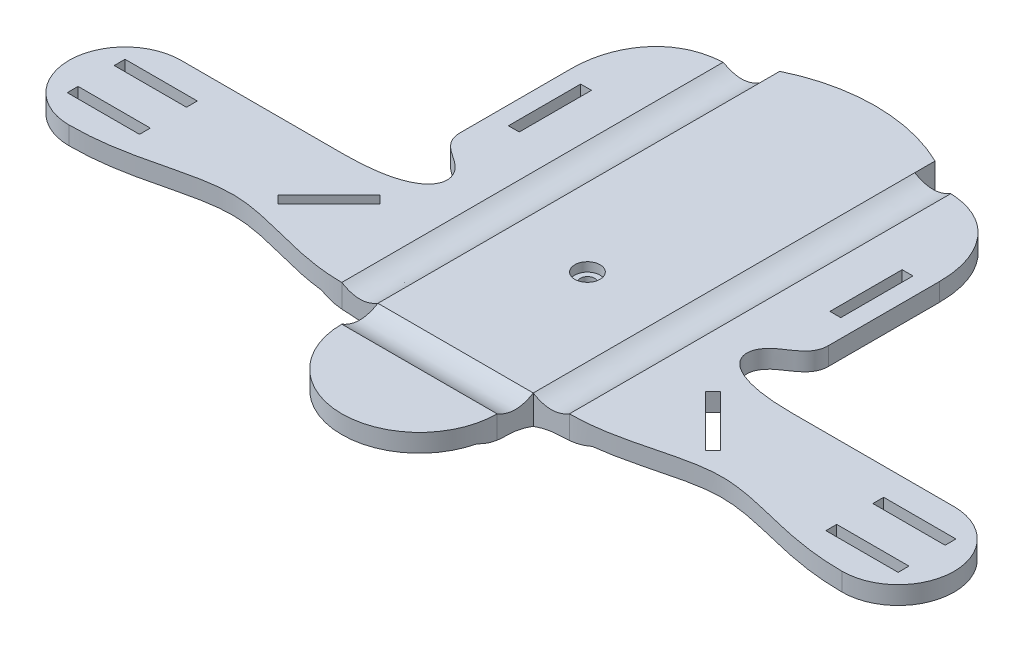
from build123d import *

# Parameters (mm, degrees)
SANDAL_DESIGN_W         = 20
SANDAL_DESIGN_H         = 3
SANDAL_DESIGN_W_2       = 3
SANDAL_DESIGN_H_2       = 20
BOSS_EXTRUDE1_DEPTH     = 8
BOSS_EXTRUDE2_DEPTH     = 2.5
CUT_EXTRUDE3_REACH      = 204.072
SKETCH6_R               = 2
SKETCH7_R               = 3.5
CUT_EXTRUDE4_DEPTH      = 2.5
CUT_EXTRUDE5_DEPTH      = 202.957076727
CUT_EXTRUDE5_DEPTH_BACK = 202.957076727
CUT_EXTRUDE6_DEPTH      = 202.957076669
CUT_EXTRUDE6_DEPTH_BACK = 202.957076669


with BuildPart() as part:
    # Sandal Design → Boss-Extrude1 (new body)
    with BuildSketch(Plane(origin=(0, 0, 0), x_dir=(1, 0, 0), z_dir=(0, 1, 0))):
        with BuildLine():
            Line((12.5, 105.618176015), (21, 105.618176015))
            Line((21, 105.618176015), (21, 111.2308341))
            ThreePointArc((21, 111.2308341), (42.5, 116.179433559), (64, 111.2308341))
            Line((64, 111.2308341), (64, 105.618176015))
            Line((64, 105.618176015), (72.5, 105.618176015))
            add(Edge.make_bspline(
                [(93.5, 82.999999948), (93.5, 91.196820649), (88.204207077, 102.224600535), (77.563477886, 105.618176015), (72.5, 105.618176015)],
                knots=[0, 0, 0, 0, 0.612935635, 1, 1, 1, 1], degree=3))
            Line((93.5, 82.999999948), (93.5, 52.191849548))
            add(Edge.make_bspline(
                [(93.5, 52.191849548), (93.5, 47.540394127), (80.104553071, 43.201826505), (83.23130825, 31.001751884), (104.5, 31.001751884)],
                knots=[0, 0, 0, 0, 0.331226387, 1, 1, 1, 1], degree=3))
            Line((104.5, 31.001751884), (149.5, 31.001751884))
            ThreePointArc((149.5, 31.001751884), (165, 15.501651435), (149.499799102, 0.001751885))
            add(Edge.make_bspline(
                [(74, 0), (87.494084825, 0), (111.347806875, 12.069263412), (131.926415328, 0.001979657), (149.499799102, 0.001751885)],
                knots=[0, 0, 0, 0, 0.462855682, 1, 1, 1, 1], degree=3))
            Line((74, 0), (64, 0))
            Line((64, 0), (64, -10))
            ThreePointArc((64, -10), (42.5, -31.5), (21, -10))
            Line((21, -10), (21, 0))
            Line((21, 0), (11, 0))
            add(Edge.make_bspline(
                [(11, 0), (-2.494084825, 0), (-26.347806875, 12.069263412), (-46.926415328, 0.001979657), (-64.499799102, 0.001751885)],
                knots=[0, 0, 0, 0, 0.462855682, 1, 1, 1, 1], degree=3))
            ThreePointArc((-64.499799102, 0.001751885), (-80, 15.501651435), (-64.5, 31.001751884))
            Line((-64.5, 31.001751884), (-19.5, 31.001751884))
            add(Edge.make_bspline(
                [(-8.5, 52.191849548), (-8.5, 47.540394127), (4.895446929, 43.201826505), (1.76869175, 31.001751884), (-19.5, 31.001751884)],
                knots=[0, 0, 0, 0, 0.331226387, 1, 1, 1, 1], degree=3))
            Line((-8.5, 52.191849548), (-8.5, 82.999999948))
            add(Edge.make_bspline(
                [(-8.5, 82.999999948), (-8.5, 91.196820649), (-3.204207077, 102.224600535), (7.436522114, 105.618176015), (12.5, 105.618176015)],
                knots=[0, 0, 0, 0, 0.612935635, 1, 1, 1, 1], degree=3))
        make_face()
        Polygon((101.642135624, 10), (103.763455967, 12.121320344), (89.621320344, 26.263455967), (87.5, 24.142135624), align=None, mode=Mode.SUBTRACT)
        Polygon((157.5, 23.501751884), (137.5, 23.501751884), (137.5, 20.501751884), (157.5, 20.501751885), align=None, mode=Mode.SUBTRACT)
        with Locations((147.5, 9.001751885)):
            Rectangle(SANDAL_DESIGN_W, SANDAL_DESIGN_H, mode=Mode.SUBTRACT)
        Polygon((-4.621320344, 26.263455967), (-2.5, 24.142135624), (-16.642135624, 10), (-18.763455967, 12.121320344), align=None, mode=Mode.SUBTRACT)
        Polygon((-52.5, 23.501751884), (-52.5, 20.501751884), (-72.5, 20.501751885), (-72.5, 23.501751884), align=None, mode=Mode.SUBTRACT)
        with Locations((-62.5, 9.001751885)):
            Rectangle(SANDAL_DESIGN_W, SANDAL_DESIGN_H, mode=Mode.SUBTRACT)
        with Locations((-2, 70.618176015)):
            Rectangle(SANDAL_DESIGN_W_2, SANDAL_DESIGN_H_2, mode=Mode.SUBTRACT)
        with Locations((87, 70.618176015)):
            Rectangle(SANDAL_DESIGN_W_2, SANDAL_DESIGN_H_2, mode=Mode.SUBTRACT)
    extrude(amount=BOSS_EXTRUDE1_DEPTH)

    # Sketch4 → Boss-Extrude2 (add)
    with BuildSketch(Plane.XZ):
        with BuildLine():
            Line((64, -15.577524047), (64, -57.422475953))
            ThreePointArc((64, -57.422475953), (42.5, -66.5), (21, -57.422475953))
            Line((21, -57.422475953), (21, -15.577524047))
            ThreePointArc((21, -15.577524047), (42.5, -6.5), (64, -15.577524047))
        make_face()
    extrude(amount=BOSS_EXTRUDE2_DEPTH)

    # Sketch6 → Cut-Extrude3 (cut, up to next)
    with BuildSketch(Plane.XZ.offset(2.5), mode=Mode.PRIVATE) as cut_extrude3_sk1:
        with Locations((42.5, -36.5)):
            Circle(SKETCH6_R)
    cut_extrude3_tool1 = extrude(cut_extrude3_sk1.sketch, amount=-CUT_EXTRUDE3_REACH, mode=Mode.PRIVATE) & part.part
    add(cut_extrude3_tool1.solids().sort_by_distance((42.5, -2.5, -36.5))[0], mode=Mode.SUBTRACT)

    # Sketch7 → Cut-Extrude4 (cut)
    with BuildSketch(Plane(origin=(0, 8, 0), x_dir=(1, 0, 0), z_dir=(0, 1, 0))):
        with Locations((42.5, 36.5)):
            Circle(SKETCH7_R)
    extrude(amount=-CUT_EXTRUDE4_DEPTH, mode=Mode.SUBTRACT)

    # Sketch8 → Cut-Extrude5 (cut, two sides: drawn at the far end of the back side and taken through both)
    with BuildSketch(Plane.XY.offset(-CUT_EXTRUDE5_DEPTH_BACK)):
        with BuildLine():
            Line((-80, 3), (-80, 0))
            Line((-80, 0), (21, 0))
            add(Edge.make_bspline(
                [(21, 0), (18.333333333, 1), (15.666666667, 1.5), (10.333333332, 1.5), (7.666665836, 2), (5, 3)],
                knots=[0, 0, 0, 0, 0.5, 0.5, 1, 1, 1, 1], degree=3))
            Line((5, 3), (-80, 3))
        make_face()
        with BuildLine():
            Line((21, 8), (11, 8))
            add(Edge.make_bspline(
                [(11, 8), (16, 5), (21, 8)],
                knots=[0, 0, 0, 1, 1, 1], degree=2))
        make_face()
        with BuildLine():
            Line((165, 0), (165, 3))
            Line((165, 3), (80, 3))
            add(Edge.make_bspline(
                [(80, 3), (77.333334157, 2), (74.666666668, 1.5), (69.333333333, 1.5), (66.666666663, 0.999999999), (64, 0)],
                knots=[0, 0, 0, 0, 0.5, 0.5, 1, 1, 1, 1], degree=3))
            Line((64, 0), (165, 0))
        make_face()
        with BuildLine():
            add(Edge.make_bspline(
                [(74, 8), (69, 5), (64, 8)],
                knots=[0, 0, 0, 1, 1, 1], degree=2))
            Line((74, 8), (64, 8))
        make_face()
    extrude(amount=CUT_EXTRUDE5_DEPTH + CUT_EXTRUDE5_DEPTH_BACK, mode=Mode.SUBTRACT)

    # Sketch9 → Cut-Extrude6 (cut, two sides: drawn at the far end of the back side and taken through both)
    with BuildSketch(Plane(origin=(0, 0, 0), x_dir=(0, 0, -1), z_dir=(1, 0, 0)).offset(-CUT_EXTRUDE6_DEPTH_BACK)):
        with BuildLine():
            Line((0.001751885, 8), (-10, 8))
            add(Edge.make_bspline(
                [(-10, 8), (-4.999268662, 4.999999923), (0.001751885, 8)],
                knots=[0, 0, 0, 1, 1, 1], degree=2))
        make_face()
        with BuildLine():
            Line((-31.5, 3), (-31.5, 0))
            Line((-31.5, 0), (0, 0))
            add(Edge.make_bspline(
                [(0, 0), (-2.5, 1), (-5, 1.5), (-10, 1.5), (-12.499999996, 2), (-15, 3)],
                knots=[0, 0, 0, 0, 0.5, 0.5, 1, 1, 1, 1], degree=3))
            Line((-15, 3), (-31.5, 3))
        make_face()
    extrude(amount=CUT_EXTRUDE6_DEPTH + CUT_EXTRUDE6_DEPTH_BACK, mode=Mode.SUBTRACT)

    # Sketch12 → Revolve1 (revolve)
    with BuildSketch(Plane(origin=(42.5, 0, 0), x_dir=(0, 0, -1), z_dir=(1, 0, 0))):
        Polygon((34.5, -2.5), (34.5, 0), (15.577524047, 0), (6.5, -2.5), align=None)
    revolve(axis=Axis((42.5, -2.5, -36.5), (0, 1, 0)))


solid = part.part
